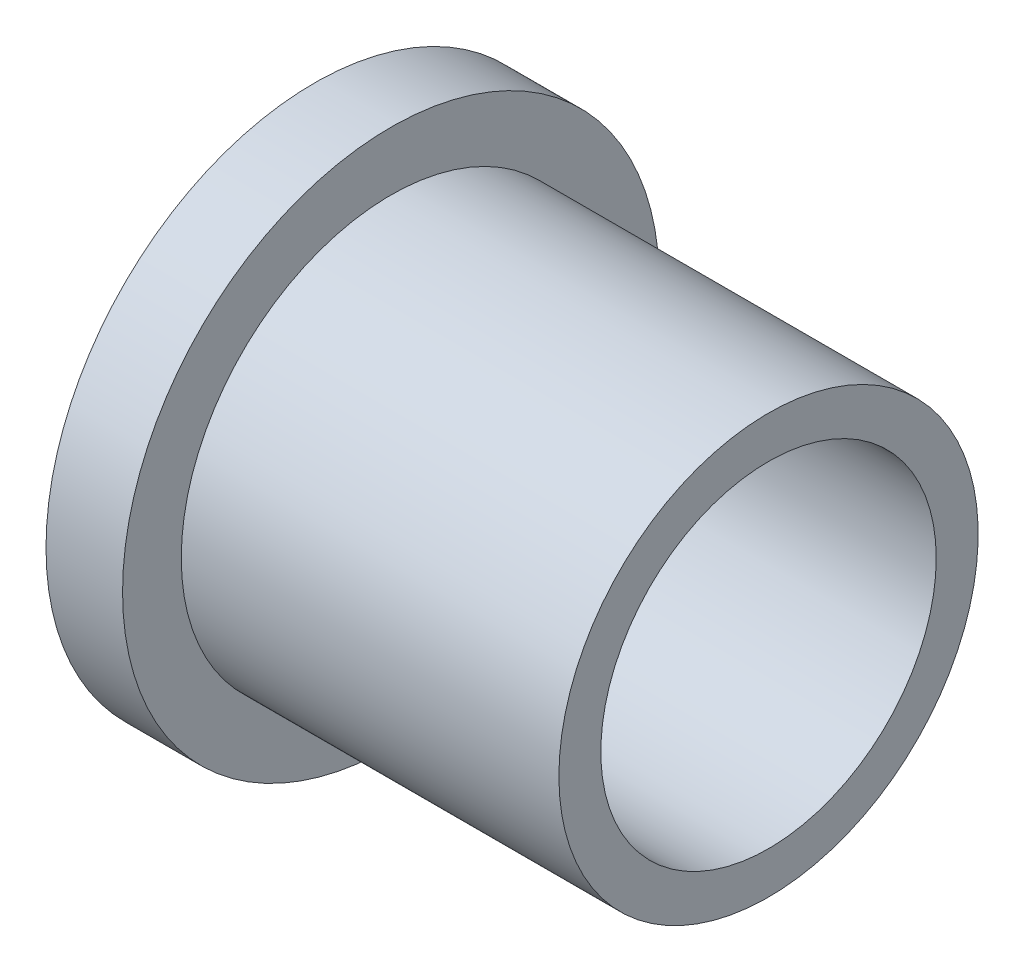
from build123d import *

# Parameters (mm, degrees)
SKETCH2_R          = 10
CUT_EXTRUDE1_DEPTH = 36.289305649


with BuildPart() as part:
    # Sketch1 → Revolve1 (revolve)
    with BuildSketch(Plane.XY):
        Polygon((-10.060536524, 12.5), (12.454682641, 12.5), (12.454682641, 0), (-10.060536524, 0), (-14.625477867, 0), (-14.625477867, 16), (-10.060536524, 16), align=None)
    revolve(axis=Axis((-46.657439154, 0, 0), (1, 0, 0)))

    # Sketch2 → Cut-Extrude1 (cut, through all)
    with BuildSketch(Plane(origin=(12.454682641, 0, 0), x_dir=(0, 0, -1), z_dir=(1, 0, 0))):
        Circle(SKETCH2_R)
    extrude(amount=-CUT_EXTRUDE1_DEPTH, mode=Mode.SUBTRACT)


solid = part.part
